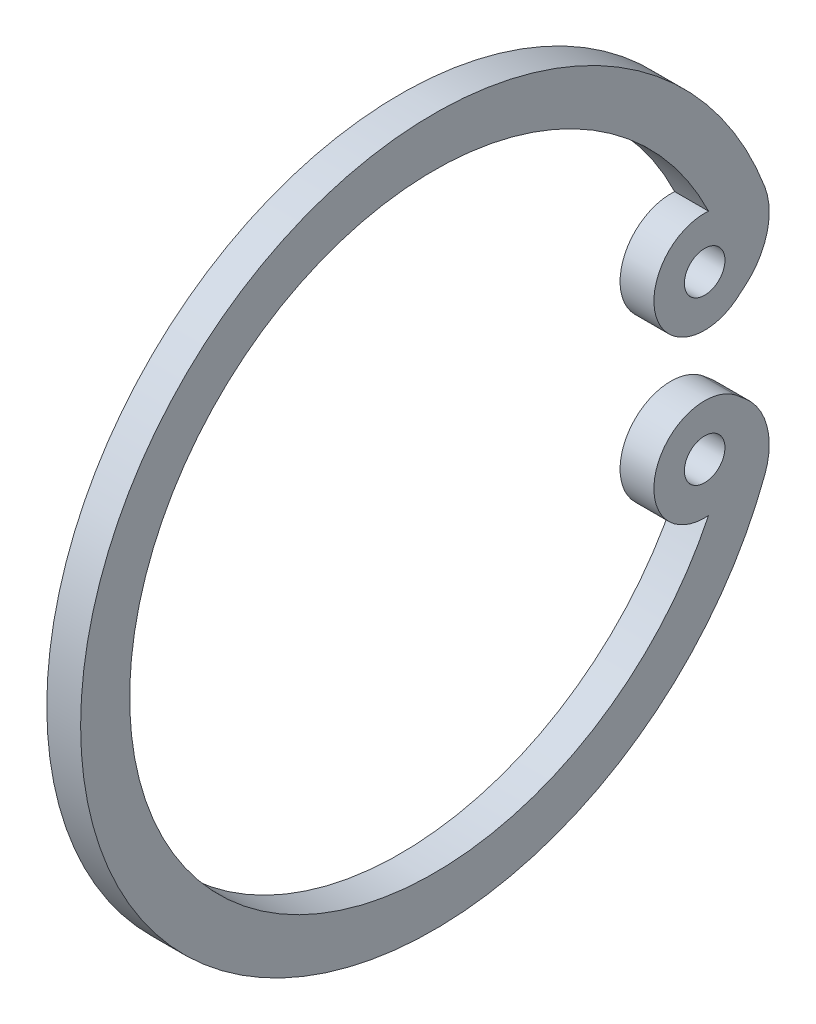
from build123d import *

# Parameters (mm, degrees)
SKETCH1_R           = 0.6
BOSS_EXTRUDE1_DEPTH = 1
SCALE1_SCALE        = 0.222222222


with BuildPart() as part:
    # Sketch1 → Boss-Extrude1 (new body)
    with BuildSketch(Plane(origin=(19, 0, 0), x_dir=(0, 0, -1), z_dir=(1, 0, 0))):
        with BuildLine():
            Line((-1.082906578, 1.214226965), (-0.806260325, 1.444819657))
            ThreePointArc((-0.806260325, 1.444819657), (-0.157167996, 2.46989624), (-0.220083072, 3.681566388))
            ThreePointArc((-0.220083072, 3.681566388), (-20.449170804, -0.000103807), (-0.220095755, -3.681843689))
            ThreePointArc((-0.220095755, -3.681843689), (-0.157177378, -2.470170425), (-0.806270581, -1.44509051))
            Line((-0.806270581, -1.44509051), (-1.082193901, -1.213563353))
            ThreePointArc((-1.082193901, -1.213563353), (-3.437745717, -1.969386585), (-1.886859109, -3.896727719))
            ThreePointArc((-1.886859109, -3.896727719), (-18.999593972, -0.000121806), (-1.886859109, 3.896484108))
            ThreePointArc((-1.886859109, 3.896484108), (-3.437385157, 1.97013231), (-1.082906578, 1.214226965))
        make_face()
        with Locations((-2.00000003, -2.4)):
            Circle(SKETCH1_R, mode=Mode.SUBTRACT)
        with Locations((-2.00000003, 2.4)):
            Circle(SKETCH1_R, mode=Mode.SUBTRACT)
    extrude(amount=-BOSS_EXTRUDE1_DEPTH)


with BuildPart() as part_1:
    # Scale1: scaled about (18.5, -0.000178585, 9.916688181)
    add(part.part.scale(SCALE1_SCALE).moved(Location((14.388888889, -0.000138899, 7.712979696))))


solid = part_1.part
